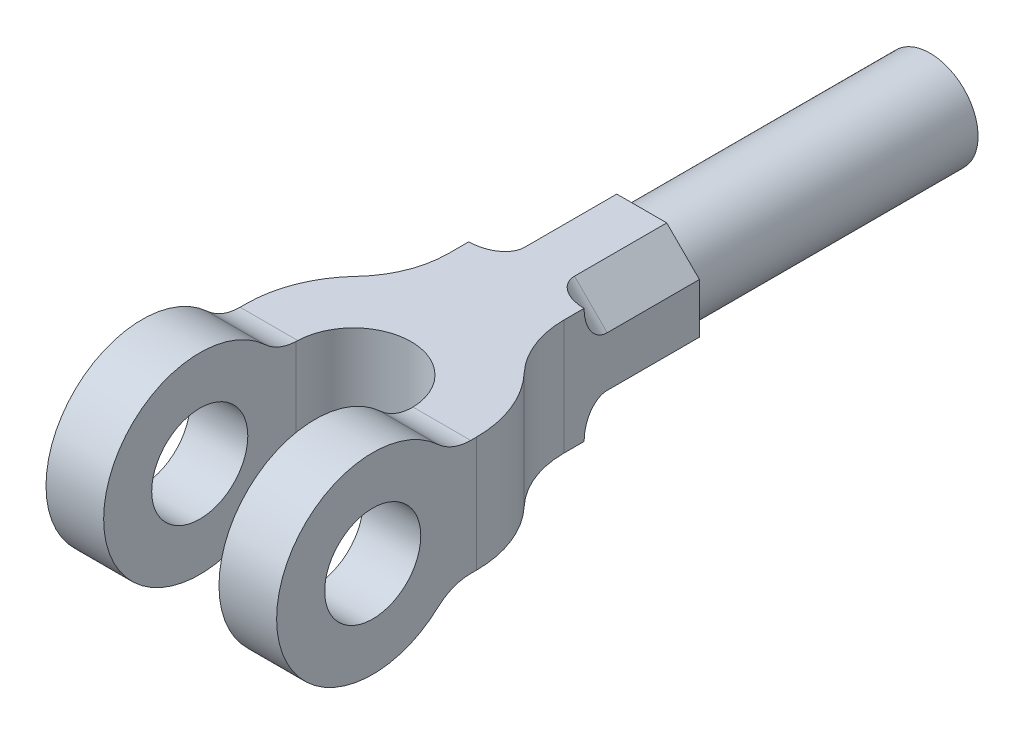
from build123d import *

# Parameters (mm, degrees)
SKETCH1_W           = 1200
SKETCH1_H           = 2500
BOSS_EXTRUDE1_DEPTH = 1000
CUT_EXTRUDE1_DEPTH  = 1000
SKETCH3_R           = 250
CUT_EXTRUDE4_DEPTH  = 1315
CUT_EXTRUDE9_DEPTH  = 600
SKETCH4_3_R         = 250
BOSS_EXTRUDE2_DEPTH = 1500
FILLET1_R           = 120
FILLET2_R           = 120
FILLET3_R           = 120
FILLET4_R           = 120


with BuildPart() as part:
    # Sketch1 → Boss-Extrude1 (new body)
    with BuildSketch(Plane(origin=(0, 0, 0), x_dir=(1, 0, 0), z_dir=(0, 1, 0))):
        Rectangle(SKETCH1_W, SKETCH1_H)
    extrude(amount=BOSS_EXTRUDE1_DEPTH)

    # Sketch2 → Cut-Extrude1 (cut)
    with BuildSketch(Plane(origin=(0, 1000, 0), x_dir=(1, 0, 0), z_dir=(0, 1, 0))):
        with BuildLine():
            ThreePointArc((300, -250), (0, 50), (-300, -250))
            Line((-300, -250), (-300, -1250))
            Line((-300, -1250), (300, -1250))
            Line((300, -1250), (300, -250))
        make_face()
        with BuildLine():
            Line((600, 1250), (300, 1250))
            Line((300, 1250), (300, 544.983443527))
            ThreePointArc((300, 544.983443527), (335.339811358, 360.346207058), (436.363636364, 201.809151015))
            ThreePointArc((436.363636364, 201.809151015), (557.592226956, 11.564682291), (600, -210.000003168))
            Line((600, -210.000003168), (600, 1250))
        make_face()
        with BuildLine():
            Line((-300, 544.983443527), (-300, 1250))
            Line((-300, 1250), (-600, 1250))
            Line((-600, 1250), (-600, -210))
            ThreePointArc((-600, -210), (-557.592226371, 11.564683763), (-436.363636364, 201.809151015))
            ThreePointArc((-436.363636364, 201.809151015), (-335.339811358, 360.346207058), (-300, 544.983443527))
        make_face()
    extrude(amount=-CUT_EXTRUDE1_DEPTH, mode=Mode.SUBTRACT)

    # Sketch3 → Cut-Extrude4 (cut)
    with BuildSketch(Plane(origin=(600, 0, 0), x_dir=(0, 0, -1), z_dir=(1, 0, 0))):
        with BuildLine():
            ThreePointArc((-410.06536576, 866.666666667), (-331.385141558, 817.262665937), (-240.098048641, 800))
            Line((-240.098048641, 800), (1250, 800))
            Line((1250, 800), (1250, 1000))
            Line((1250, 1000), (-750, 1000))
            ThreePointArc((-750, 1000), (-567.425814165, 965.474668126), (-410.06536576, 866.666666667))
        make_face()
        with BuildLine():
            Line((-750, 0), (1250, 0))
            Line((1250, 0), (1250, 200))
            Line((1250, 200), (-240.098048641, 200))
            ThreePointArc((-240.098048641, 200), (-331.385141558, 182.737334063), (-410.06536576, 133.333333333))
            ThreePointArc((-410.06536576, 133.333333333), (-567.425814165, 34.525331874), (-750, 0))
        make_face()
        with BuildLine():
            ThreePointArc((-1250, 500), (-1103.553390593, 853.553390593), (-750, 1000))
            Line((-750, 1000), (-1250, 1000))
            Line((-1250, 1000), (-1250, 500))
        make_face()
        with BuildLine():
            ThreePointArc((-750, 0), (-1103.553390593, 146.446609407), (-1250, 500))
            Line((-1250, 500), (-1250, 0))
            Line((-1250, 0), (-750, 0))
        make_face()
        with Locations((-750, 500)):
            Circle(SKETCH3_R)
    extrude(amount=-CUT_EXTRUDE4_DEPTH, mode=Mode.SUBTRACT)

    # Sketch4 → Cut-Extrude9 (cut)
    with BuildSketch(Plane(origin=(0, 0, -1250), x_dir=(-1, 0, 0), z_dir=(0, 0, -1))):
        Polygon((300, 630), (300, 800), (130, 800), align=None)
        Polygon((300, 200), (300, 370), (130, 200), align=None)
        Polygon((-300, 200), (-130, 200), (-300, 370), align=None)
        Polygon((-300, 800), (-300, 630), (-130, 800), align=None)
    extrude(amount=-CUT_EXTRUDE9_DEPTH, mode=Mode.SUBTRACT)

    # Sketch4<3> → Boss-Extrude2 (add)
    with BuildSketch(Plane(origin=(0, 0, -1250), x_dir=(-1, 0, 0), z_dir=(0, 0, -1))):
        with Locations((0, 500)):
            Circle(SKETCH4_3_R)
    extrude(amount=BOSS_EXTRUDE2_DEPTH)

    # Fillet1
    fillet1_edges = [part.edges().sort_by_distance(p)[0] for p in [
        (-215, 715, -650),
    ]]
    fillet(fillet1_edges, radius=FILLET1_R)

    # Fillet2
    fillet2_edges = [part.edges().sort_by_distance(p)[0] for p in [
        (-215, 285, -650),
    ]]
    fillet(fillet2_edges, radius=FILLET2_R)

    # Fillet3
    fillet3_edges = [part.edges().sort_by_distance(p)[0] for p in [
        (215, 715, -650),
    ]]
    fillet(fillet3_edges, radius=FILLET3_R)

    # Fillet4
    fillet4_edges = [part.edges().sort_by_distance(p)[0] for p in [
        (215, 285, -650),
    ]]
    fillet(fillet4_edges, radius=FILLET4_R)


solid = part.part
